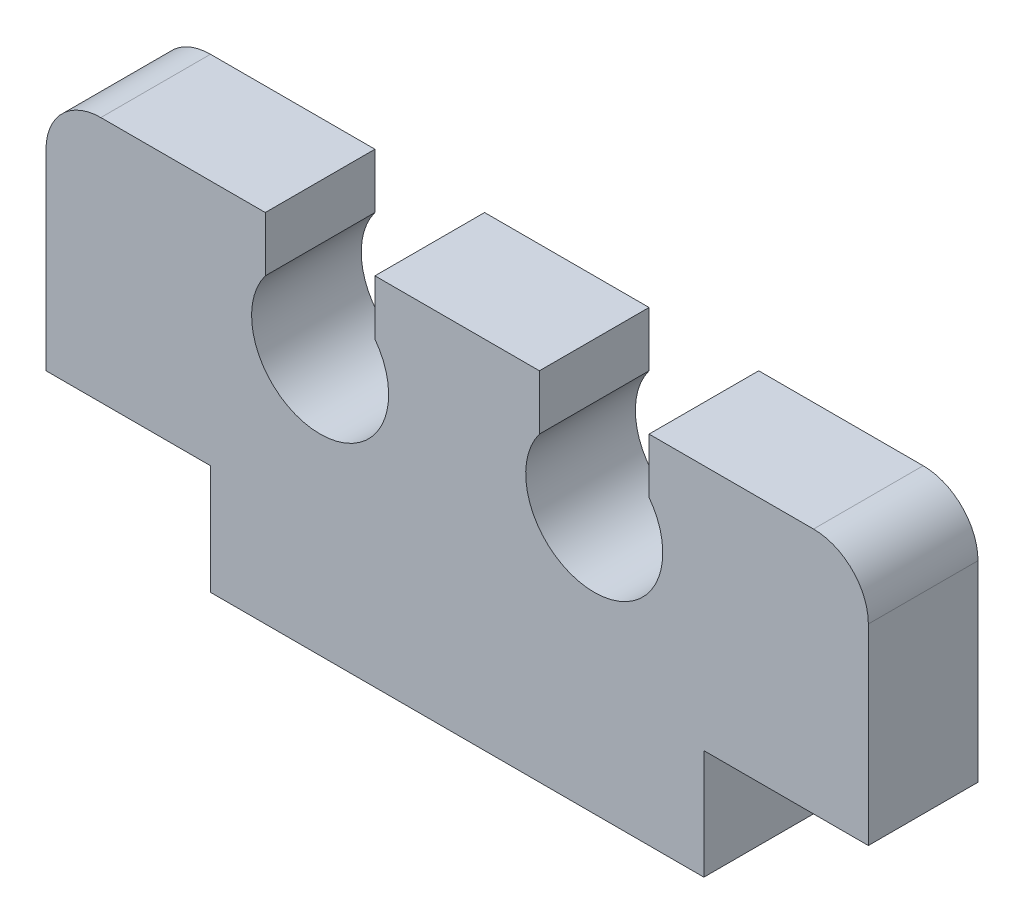
from build123d import *

# Parameters (mm, degrees)
TUBE_PLATE_MCP_BODY_DEPTH   = 2
TUBE_PLATE_MCP_CONTOURING_R = 1


with BuildPart() as part:
    # Sketch1 → Tube Plate MCP Body (new body)
    with BuildSketch(Plane.XY):
        with BuildLine():
            Line((-4.5, 0), (4.5, 0))
            Line((4.5, 0), (4.5, 2))
            Line((4.5, 2), (7.5, 2))
            Line((7.5, 2), (7.5, 6.5))
            Line((7.5, 6.5), (3.5, 6.5))
            Line((3.5, 6.5), (3.5, 5.5))
            ThreePointArc((3.5, 5.5), (2.5, 3.5), (1.5, 5.5))
            Line((1.5, 5.5), (1.5, 6.5))
            Line((1.5, 6.5), (-1.5, 6.5))
            Line((-1.5, 6.5), (-1.5, 5.5))
            ThreePointArc((-1.5, 5.5), (-2.5, 3.5), (-3.5, 5.5))
            Line((-3.5, 5.5), (-3.5, 6.5))
            Line((-3.5, 6.5), (-7.5, 6.5))
            Line((-7.5, 6.5), (-7.5, 2))
            Line((-7.5, 2), (-4.5, 2))
            Line((-4.5, 2), (-4.5, 0))
        make_face()
    extrude(amount=TUBE_PLATE_MCP_BODY_DEPTH)

    # Tube Plate MCP Contouring
    tube_plate_mcp_contouring_edges = [part.edges().sort_by_distance(p)[0] for p in [
        (7.5, 6.5, 1),
        (-7.5, 6.5, 1),
    ]]
    fillet(tube_plate_mcp_contouring_edges, radius=TUBE_PLATE_MCP_CONTOURING_R)


solid = part.part
